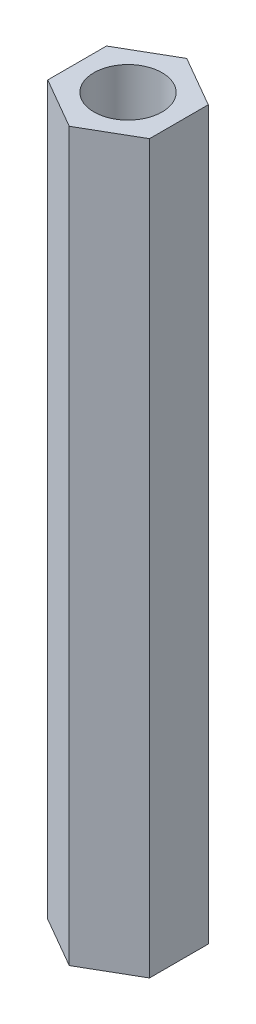
from build123d import *

# Parameters (mm, degrees)
SKETCH1_R           = 1.190625
BOSS_EXTRUDE1_DEPTH = 25.4


with BuildPart() as part:
    # Sketch1 → Boss-Extrude1 (new body)
    with BuildSketch(Plane(origin=(0, 0, 0), x_dir=(1, 0, 0), z_dir=(0, 1, 0))):
        Polygon((0, -2.053057557), (1.778, -1.026528779), (1.778, 1.026528779), (0, 2.053057557), (-1.778, 1.026528779), (-1.778, -1.026528779), align=None)
        Circle(SKETCH1_R, mode=Mode.SUBTRACT)
    extrude(amount=BOSS_EXTRUDE1_DEPTH)


solid = part.part
